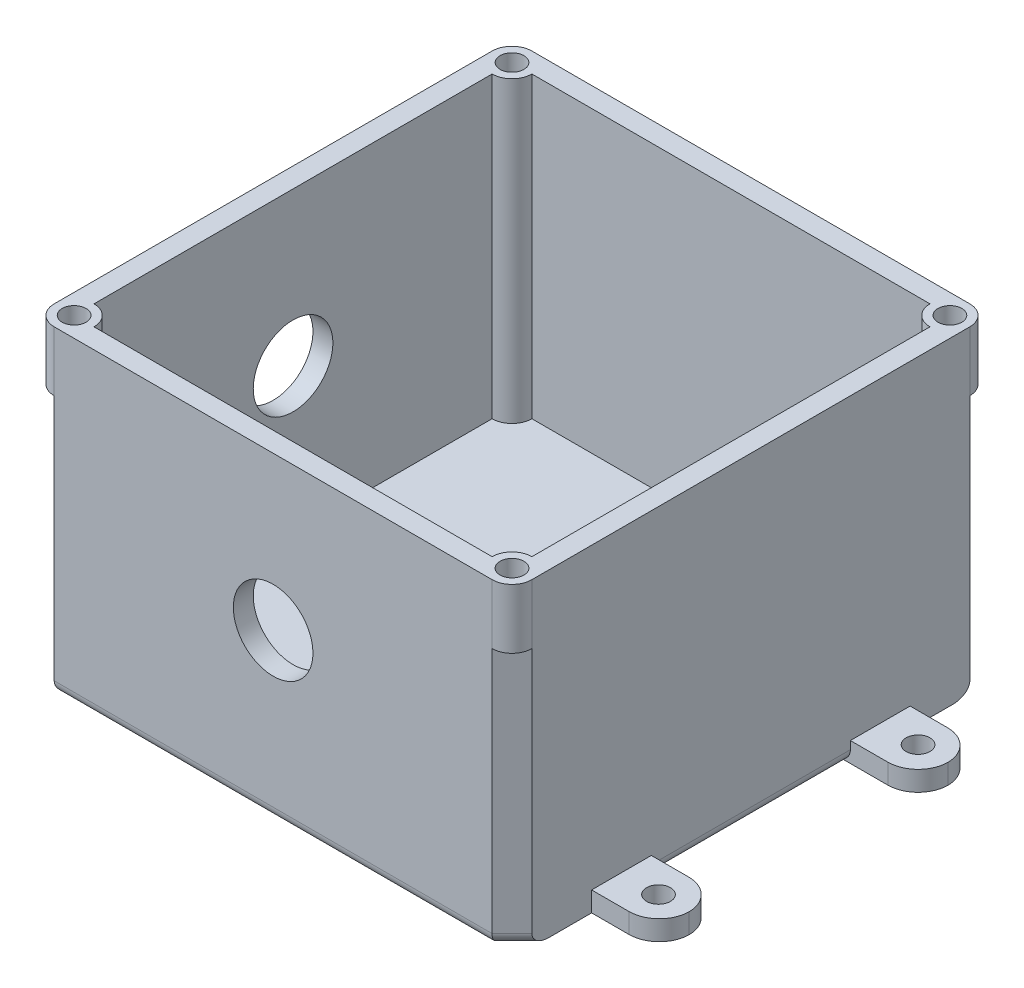
from build123d import *

# Parameters (mm, degrees)
SKETCH1_W           = 152.4
SKETCH1_H           = 152.4
BOSS_EXTRUDE1_DEPTH = 101.6
SKETCH2_W           = 25.4
SKETCH2_H           = 19.05
BOSS_EXTRUDE2_DEPTH = 6.35
SKETCH3_W           = 139.7
SKETCH3_H           = 139.7
CUT_EXTRUDE1_DEPTH  = 95.25
FILLET1_R           = 9.652
CHAMFER1_SIZE       = 6.35
SKETCH4_R           = 3.81
CUT_EXTRUDE2_DEPTH  = 171.275704178
FILLET2_R           = 3.81
SKETCH5_R           = 6.35
BOSS_EXTRUDE3_DEPTH = 19.05
BOSS_EXTRUDE4_DEPTH = 95.25
SKETCH6_R           = 3.81
CUT_EXTRUDE3_DEPTH  = 17.272
CUT_EXTRUDE4_REACH  = 210.646
SKETCH8_R           = 12.7
CUT_EXTRUDE5_REACH  = 226.792
SKETCH9_R           = 12.7


with BuildPart() as part:
    # Sketch1 → Boss-Extrude1 (new body)
    with BuildSketch(Plane(origin=(0, 0, 0), x_dir=(1, 0, 0), z_dir=(0, 1, 0))):
        with Locations((2.134713764, -23.481851401)):
            Rectangle(SKETCH1_W, SKETCH1_H)
    extrude(amount=BOSS_EXTRUDE1_DEPTH)

    # Sketch2 → Boss-Extrude2 (add)
    with BuildSketch(Plane(origin=(0, 0, 0), x_dir=(1, 0, 0), z_dir=(0, 1, 0))):
        with Locations((87.224713764, -64.756851401)):
            Rectangle(SKETCH2_W, SKETCH2_H)
        with Locations((-82.955286236, -64.756851401)):
            Rectangle(SKETCH2_W, SKETCH2_H)
        with Locations((87.224713764, 17.793148599)):
            Rectangle(SKETCH2_W, SKETCH2_H)
        with Locations((-82.955286236, 17.793148599)):
            Rectangle(SKETCH2_W, SKETCH2_H)
    extrude(amount=BOSS_EXTRUDE2_DEPTH)

    # Sketch3 → Cut-Extrude1 (cut)
    with BuildSketch(Plane(origin=(0, 101.6, 0), x_dir=(1, 0, 0), z_dir=(0, 1, 0))):
        with Locations((2.134713764, -23.481851401)):
            Rectangle(SKETCH3_W, SKETCH3_H)
    extrude(amount=-CUT_EXTRUDE1_DEPTH, mode=Mode.SUBTRACT)

    # Fillet1
    # the kernel refuses this fillet: 9.652 mm, written as the material it takes off along each edge
    with BuildSketch(Plane(origin=(-95.655286236, -24.13, -27.318148599), x_dir=(1, 0, 0), z_dir=(0, 1, 0)), Plane(origin=(-95.655286236, -24.13, 55.231851401), x_dir=(1, 0, 0), z_dir=(0, 1, 0)), Plane(origin=(99.924713764, -24.13, -8.268148599), x_dir=(-1, 0, 0), z_dir=(0, 1, 0)), Plane(origin=(99.924713764, -24.13, 74.281851401), x_dir=(-1, 0, 0), z_dir=(0, 1, 0))) as fillet1_piece_1:
        with BuildLine():
            CenterArc((FILLET1_R, -FILLET1_R), FILLET1_R, 90, 90)
            Line((0, -FILLET1_R), (0, 0))
            Line((0, 0), (FILLET1_R, 0))
        make_face()
    extrude(amount=54.61, mode=Mode.SUBTRACT)
    with BuildSketch(Plane(origin=(-95.655286236, -24.13, -8.268148599), x_dir=(1, 0, 0), z_dir=(0, 1, 0)), Plane(origin=(-95.655286236, -24.13, 74.281851401), x_dir=(1, 0, 0), z_dir=(0, 1, 0)), Plane(origin=(99.924713764, -24.13, -27.318148599), x_dir=(-1, 0, 0), z_dir=(0, 1, 0)), Plane(origin=(99.924713764, -24.13, 55.231851401), x_dir=(-1, 0, 0), z_dir=(0, 1, 0))) as fillet1_piece_2:
        with BuildLine():
            CenterArc((FILLET1_R, FILLET1_R), FILLET1_R, 180, 90)
            Line((0, FILLET1_R), (0, 0))
            Line((0, 0), (FILLET1_R, 0))
        make_face()
    extrude(amount=54.61, mode=Mode.SUBTRACT)

    # Chamfer1
    chamfer1_edges = [part.edges().sort_by_distance(p)[0] for p in [
        (-74.065286236, 50.8, -52.718148599),
        (78.334713764, 50.8, -52.718148599),
        (78.334713764, 50.8, 99.681851401),
        (-74.065286236, 50.8, 99.681851401),
    ]]
    chamfer(chamfer1_edges, length=CHAMFER1_SIZE)

    # Sketch4 → Cut-Extrude2 (cut, through all)
    with BuildSketch(Plane(origin=(0, 6.35, 0), x_dir=(1, 0, 0), z_dir=(0, 1, 0))):
        with Locations(Location((90.272713764, -64.883851401, 0), (0, 0, 270))):
            Circle(SKETCH4_R)
        with Locations(Location((-86.003286236, -64.883851401, 0), (0, 0, 90))):
            Circle(SKETCH4_R)
        with Locations(Location((90.272713764, 17.920148599, 0), (0, 0, 90))):
            Circle(SKETCH4_R)
        with Locations(Location((-86.003286236, 17.920148599, 0), (0, 0, 270))):
            Circle(SKETCH4_R)
    extrude(amount=-CUT_EXTRUDE2_DEPTH, mode=Mode.SUBTRACT)

    # Fillet2
    fillet2_edges = [part.edges().sort_by_distance(p)[0] for p in [
        (-70.890286236, 0, 96.506851401),
        (-74.065286236, 0, 23.481851401),
        (-70.890286236, 0, -49.543148599),
        (2.134713764, 0, -52.718148599),
        (75.159713764, 0, -49.543148599),
        (78.334713764, 0, 23.481851401),
        (75.159713764, 0, 96.506851401),
        (2.134713764, 0, 99.681851401),
    ]]
    fillet(fillet2_edges, radius=FILLET2_R)

    # Sketch5 → Boss-Extrude3 (add)
    with BuildSketch(Plane(origin=(0, 101.6, 0), x_dir=(1, 0, 0), z_dir=(0, 1, 0))):
        with Locations((71.984713764, -93.331851401)):
            Circle(SKETCH5_R)
        with Locations((-67.715286236, -93.331851401)):
            Circle(SKETCH5_R)
        with Locations((-67.715286236, 46.368148599)):
            Circle(SKETCH5_R)
        with Locations((71.984713764, 46.368148599)):
            Circle(SKETCH5_R)
    extrude(amount=-BOSS_EXTRUDE3_DEPTH)

    # Sketch7 → Boss-Extrude4 (add)
    with BuildSketch(Plane(origin=(0, 101.6, 0), x_dir=(1, 0, 0), z_dir=(0, 1, 0))):
        with BuildLine():
            Line((71.984713764, -99.681851401), (78.334713764, -93.331851401))
            ThreePointArc((78.334713764, -93.331851401), (67.494585703, -88.84172334), (71.984713764, -99.681851401))
        make_face()
        with BuildLine():
            Line((-67.715286236, -99.681851401), (-74.065286236, -93.331851401))
            ThreePointArc((-74.065286236, -93.331851401), (-63.225158176, -88.84172334), (-67.715286236, -99.681851401))
        make_face()
        with BuildLine():
            Line((71.984713764, 52.718148599), (78.334713764, 46.368148599))
            ThreePointArc((78.334713764, 46.368148599), (67.494585703, 41.878020539), (71.984713764, 52.718148599))
        make_face()
        with BuildLine():
            Line((-67.715286236, 52.718148599), (-74.065286236, 46.368148599))
            ThreePointArc((-74.065286236, 46.368148599), (-63.225158176, 41.878020539), (-67.715286236, 52.718148599))
        make_face()
    extrude(amount=-BOSS_EXTRUDE4_DEPTH)

    # Sketch6 → Cut-Extrude3 (cut)
    with BuildSketch(Plane(origin=(0, 101.6, 0), x_dir=(1, 0, 0), z_dir=(0, 1, 0))):
        with Locations(Location((71.984713764, -93.331851401, 0), (0, 0, 270))):
            Circle(SKETCH6_R)
        with Locations(Location((-67.715286236, -93.331851401, 0), (0, 0, 90))):
            Circle(SKETCH6_R)
        with Locations(Location((71.984713764, 46.368148599, 0), (0, 0, 90))):
            Circle(SKETCH6_R)
        with Locations(Location((-67.715286236, 46.368148599, 0), (0, 0, 270))):
            Circle(SKETCH6_R)
    extrude(amount=-CUT_EXTRUDE3_DEPTH, mode=Mode.SUBTRACT)

    # Sketch8 → Cut-Extrude4 (cut, up to next)
    with BuildSketch(Plane.XY.offset(99.681851401), mode=Mode.PRIVATE) as cut_extrude4_sk1:
        with Locations((2.134713764, 52.705)):
            Circle(SKETCH8_R)
    cut_extrude4_tool1 = extrude(cut_extrude4_sk1.sketch, amount=-CUT_EXTRUDE4_REACH, mode=Mode.PRIVATE) & part.part
    add(cut_extrude4_tool1.solids().sort_by_distance((2.134714, 52.705, 99.681851))[0], mode=Mode.SUBTRACT)

    # Sketch9 → Cut-Extrude5 (cut, up to next)
    with BuildSketch(Plane.ZY.offset(74.065286236), mode=Mode.PRIVATE) as cut_extrude5_sk1:
        with Locations((23.481851401, 52.705)):
            Circle(SKETCH9_R)
    cut_extrude5_tool1 = extrude(cut_extrude5_sk1.sketch, amount=-CUT_EXTRUDE5_REACH, mode=Mode.PRIVATE) & part.part
    add(cut_extrude5_tool1.solids().sort_by_distance((-74.065286, 52.705, 23.481851))[0], mode=Mode.SUBTRACT)


solid = part.part
